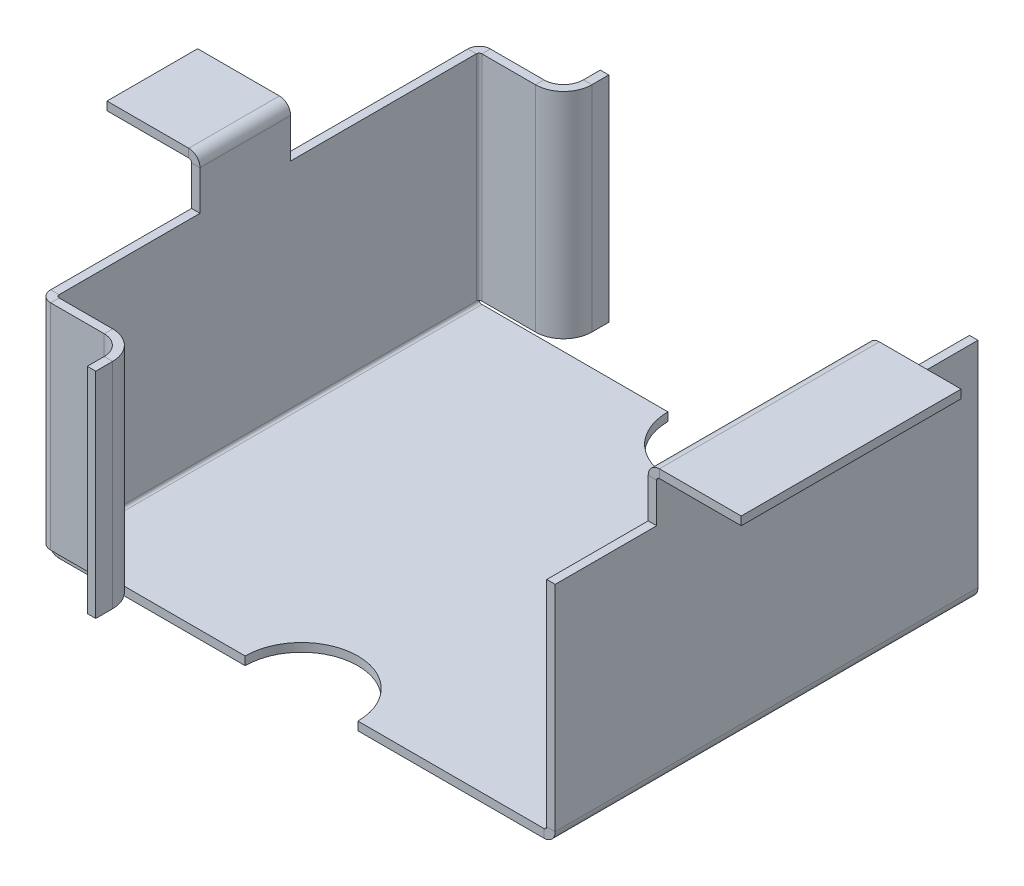
from build123d import *

# Parameters (mm, degrees)
BASE_FLANGE1_DEPTH      = 75
SKETCH4_R               = 20
CUT_EXTRUDE1_DEPTH      = 3
MITER_START             = 4
MITER_FLANGE1_DEPTH     = 76
MITER_FLANGE1_2_DEPTH   = 76
EDGE_FLANGE1_DEPTH      = 78
EDGE_FLANGE1_BEND_DEPTH = 32.152557442


# Read off the part's stored shape, not the designer's step: Miter Flange1
# Sheet-metal steps are written as plain solids
with BuildPart() as part:
    # Sketch1 → Base-Flange1 (new body)
    with BuildSketch(Plane.XY):
        with BuildLine():
            Line((-90, 80), (-90, 4))
            ThreePointArc((-90, 4), (-88.828427125, 1.171572875), (-86, 0))
            Line((-86, 0), (86, 0))
            ThreePointArc((86, 0), (88.828427125, 1.171572875), (90, 4))
            Line((90, 4), (90, 80))
            Line((90, 80), (87, 80))
            Line((87, 80), (87, 4))
            ThreePointArc((87, 4), (86.707106781, 3.292893219), (86, 3))
            Line((86, 3), (-86, 3))
            ThreePointArc((-86, 3), (-86.707106781, 3.292893219), (-87, 4))
            Line((-87, 4), (-87, 80))
            Line((-87, 80), (-90, 80))
        make_face()
    extrude(amount=BASE_FLANGE1_DEPTH)

    # Sketch4 → Cut-Extrude1 (cut)
    with BuildSketch(Plane(origin=(0, 3, 0), x_dir=(1, 0, 0), z_dir=(0, 1, 0))):
        Circle(SKETCH4_R)
    extrude(amount=-CUT_EXTRUDE1_DEPTH, mode=Mode.SUBTRACT)

    # Miter Flange1 outline → Miter Flange1 (cut)
    with BuildSketch(Plane(origin=(0, 0, 0), x_dir=(1, 0, 0), z_dir=(0, 1, 0)).offset(MITER_START)):
        with BuildLine():
            ThreePointArc((-90, -1), (-89.968118785, -0.49598283), (-89.872983346, 0))
            Line((-89.872983346, 0), (-90, 0))
            Line((-90, 0), (-90, -1))
        make_face()
    extrude(amount=MITER_FLANGE1_DEPTH, mode=Mode.SUBTRACT)

    # Miter Flange1 2 outline → Miter Flange1 2 (add)
    with BuildSketch(Plane(origin=(0, 0, 0), x_dir=(1, 0, 0), z_dir=(0, 1, 0)).offset(MITER_START)):
        with BuildLine():
            Line((-57, 10), (-57, 16))
            Line((-57, 16), (-60, 16))
            Line((-60, 16), (-60, 10))
            ThreePointArc((-60, 10), (-62.050252532, 5.050252532), (-67, 3))
            Line((-67, 3), (-86, 3))
            ThreePointArc((-86, 3), (-88.449489743, 2.16227766), (-89.872983346, 0))
            Line((-89.872983346, 0), (-87, 0))
            Line((-87, 0), (-87, -1))
            ThreePointArc((-87, -1), (-86.707106781, -0.292893219), (-86, 0))
            Line((-86, 0), (-67, 0))
            ThreePointArc((-67, 0), (-59.928932188, 2.928932188), (-57, 10))
        make_face()
    extrude(amount=MITER_FLANGE1_2_DEPTH)

    # Mirror1: part across plane


with BuildPart() as part_1:
    add(part.part)
    add(part.part.mirror(Plane(origin=(87, 4, 75), x_dir=(1, 0, 0), z_dir=(0, 0, 1))))

    # Edge-Flange1 section (across the edge) → Edge-Flange1 (add)
    with BuildSketch(Plane(origin=(90, 95, 36), x_dir=(0, -1, 0), z_dir=(0, 0, 1))):
        with BuildLine():
            Line((-3, 1), (-3, 30))
            Line((-3, 30), (0, 30))
            Line((0, 30), (0, 1))
            ThreePointArc((0, 1), (0.292893219, 0.292893219), (1, 0))
            Line((1, 0), (15, 0))
            Line((15, 0), (15, -3))
            Line((15, -3), (1, -3))
            ThreePointArc((1, -3), (-1.828427125, -1.828427125), (-3, 1))
        make_face()
    extrude(amount=EDGE_FLANGE1_DEPTH)

    # Edge-Flange1 section 2 (across the edge) → Edge-Flange1 bend (add)
    with BuildSketch(Plane(origin=(-90, 95, 99.006927285), x_dir=(0, -1, 0), z_dir=(0, 0, -1))):
        with BuildLine():
            Line((-3, 1), (-3, 30))
            Line((-3, 30), (0, 30))
            Line((0, 30), (0, 1))
            ThreePointArc((0, 1), (0.292893219, 0.292893219), (1, 0))
            Line((1, 0), (15, 0))
            Line((15, 0), (15, -3))
            Line((15, -3), (1, -3))
            ThreePointArc((1, -3), (-1.828427125, -1.828427125), (-3, 1))
        make_face()
    extrude(amount=EDGE_FLANGE1_BEND_DEPTH)


solid = part_1.part
